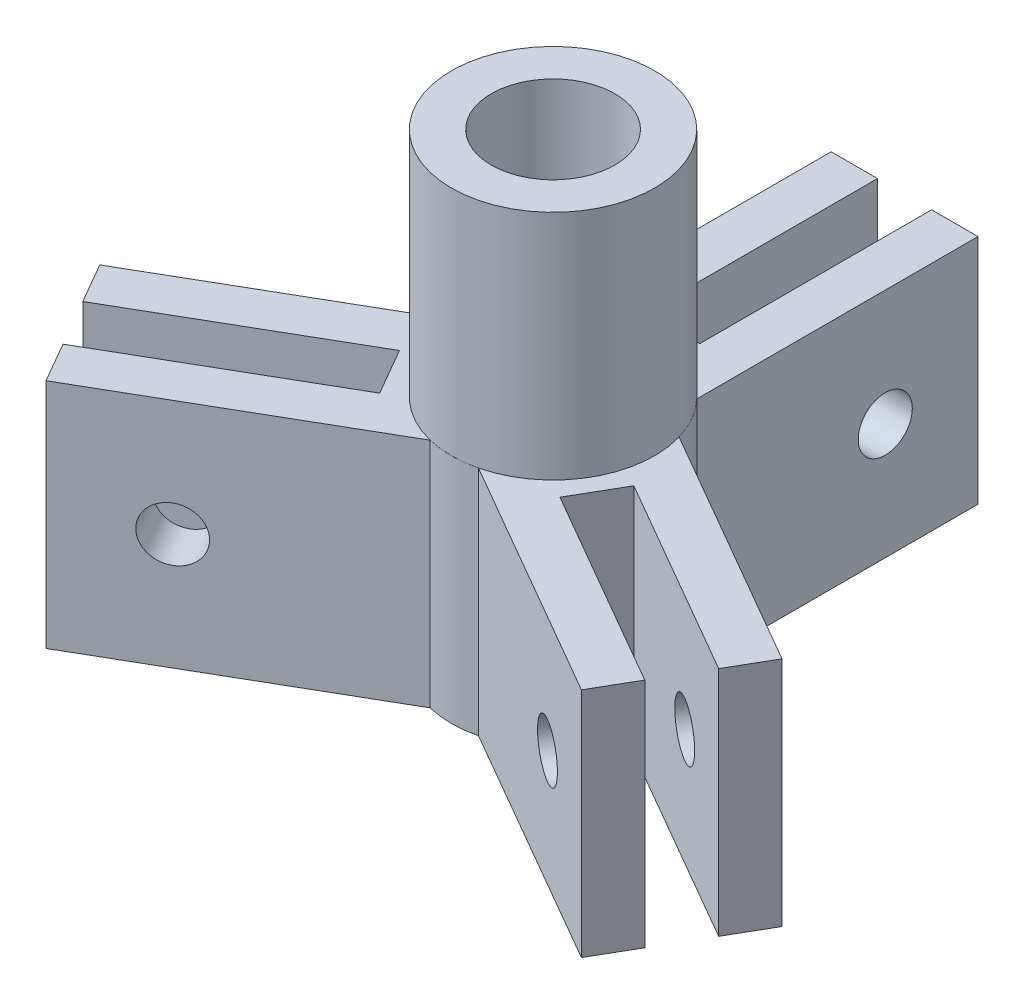
from build123d import *

# Parameters (mm, degrees)
SKETCH_1_R          = 4
EXTRUDE_2_DEPTH     = 15
SKETCH_2_R          = 6.575
SKETCH_2_R_2        = 4
EXTRUDE_3_DEPTH     = 15
SKETCH_3_R          = 1.75
CUT_EXTRUDE_1_DEPTH = 15
SKETCH_4_R          = 1.75
CUT_EXTRUDE_2_DEPTH = 15
SKETCH_5_R          = 1.75
CUT_EXTRUDE_3_DEPTH = 15


with BuildPart() as part:
    # 草圖1 → 填料-伸長2 (new body)
    with BuildSketch(Plane(origin=(0, 0, 0), x_dir=(1, 0, 0), z_dir=(0, 1, 0))):
        with BuildLine():
            Line((6.314953067, 1.838887704), (22.070508076, -7.257586221))
            Line((22.070508076, -7.257586221), (20.570508076, -9.855662433))
            Line((20.570508076, -9.855662433), (7.580127019, -2.355662433))
            Line((7.580127019, -2.355662433), (5.830127019, -5.386751346))
            Line((5.830127019, -5.386751346), (18.820508076, -12.886751346))
            Line((18.820508076, -12.886751346), (17.320508076, -15.484827557))
            Line((17.320508076, -15.484827557), (1.564953067, -6.388353632))
            ThreePointArc((1.564953067, -6.388353632), (0, -6.577244121), (-1.564953067, -6.388353632))
            Line((-1.564953067, -6.388353632), (-17.320508076, -15.484827557))
            Line((-17.320508076, -15.484827557), (-18.820508076, -12.886751346))
            Line((-18.820508076, -12.886751346), (-5.830127019, -5.386751346))
            Line((-5.830127019, -5.386751346), (-7.580127019, -2.355662433))
            Line((-7.580127019, -2.355662433), (-20.570508076, -9.855662433))
            Line((-20.570508076, -9.855662433), (-22.070508076, -7.257586221))
            Line((-22.070508076, -7.257586221), (-6.314953067, 1.838887704))
            ThreePointArc((-6.314953067, 1.838887704), (-5.696060496, 3.28862206), (-4.75, 4.549465928))
            Line((-4.75, 4.549465928), (-4.75, 22.742413779))
            Line((-4.75, 22.742413779), (-1.75, 22.742413779))
            Line((-1.75, 22.742413779), (-1.75, 7.742413779))
            Line((-1.75, 7.742413779), (1.75, 7.742413779))
            Line((1.75, 7.742413779), (1.75, 22.742413779))
            Line((1.75, 22.742413779), (4.75, 22.742413779))
            Line((4.75, 22.742413779), (4.75, 4.549465928))
            ThreePointArc((4.75, 4.549465928), (5.696060496, 3.28862206), (6.314953067, 1.838887704))
        make_face()
        Circle(SKETCH_1_R, mode=Mode.SUBTRACT)
    extrude(amount=EXTRUDE_2_DEPTH)

    # 草圖2 → 填料-伸長3 (add)
    with BuildSketch(Plane(origin=(0, 15, 0), x_dir=(1, 0, 0), z_dir=(0, 1, 0))):
        Circle(SKETCH_2_R)
        Circle(SKETCH_2_R_2, mode=Mode.SUBTRACT)
    extrude(amount=EXTRUDE_3_DEPTH)

    # 草圖3 → 除料-伸長1 (cut)
    with BuildSketch(Plane(origin=(4.75, 0, 0), x_dir=(0, 0, -1), z_dir=(1, 0, 0))):
        with Locations((16.742413779, 7.5)):
            Circle(SKETCH_3_R)
    extrude(amount=-CUT_EXTRUDE_1_DEPTH, mode=Mode.SUBTRACT)

    # 草圖4 → 除料-伸長2 (cut)
    with BuildSketch(Plane(origin=(-2.375, 0, -4.113620668), x_dir=(-0.8660254037844384, 0, 0.5000000000000004), z_dir=(-0.5000000000000004, 0, -0.8660254037844384))):
        with Locations((16.742413779, 7.5)):
            Circle(SKETCH_4_R)
    extrude(amount=-CUT_EXTRUDE_2_DEPTH, mode=Mode.SUBTRACT)

    # 草圖5 → 除料-伸長3 (cut)
    with BuildSketch(Plane(origin=(-2.375, 0, 4.113620668), x_dir=(0.8660254037844387, 0, 0.49999999999999983), z_dir=(-0.49999999999999983, 0, 0.8660254037844387))):
        with Locations((16.742413779, 7.5)):
            Circle(SKETCH_5_R)
    extrude(amount=-CUT_EXTRUDE_3_DEPTH, mode=Mode.SUBTRACT)


solid = part.part
